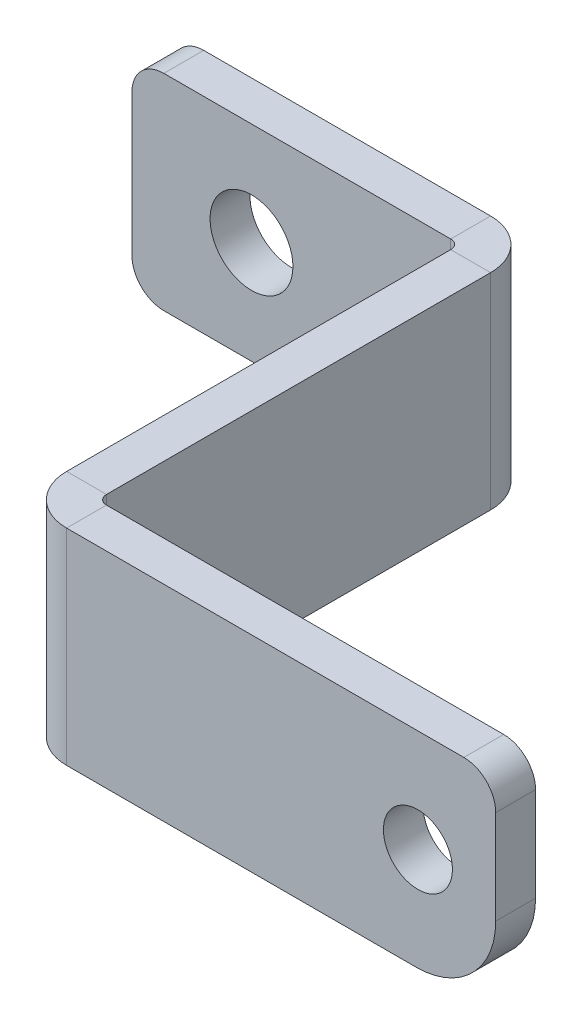
from build123d import *

# Parameters (mm, degrees)
BASE_FLANGE1_DEPTH           = 3.175
M6_CLEARANCE_HOLE1_D         = 6.6
EDGE_FLANGE1_DEPTH           = 16.378
EDGE_FLANGE2_STRIP_W         = 14.1732
EDGE_FLANGE2_STRIP_H         = 3.175
EDGE_FLANGE2_STRIP_CUT_DEPTH = 16.378
EDGE_FLANGE2_DEPTH           = 16.378
M5_CLEARANCE_HOLE1_D         = 5.5
FILLET1_R                    = 2.54
FILLET2_R                    = 6.35


# Sheet-metal steps are written as plain solids
with BuildPart() as part:
    # Sketch1 → Base-Flange1 (new body)
    with BuildSketch(Plane.XY):
        Polygon((52.8905, -45.562600001), (36.5125, -45.562600001), (36.5125, -29.184600001), (61.9125, -29.184600001), (61.9125, -45.562600001), align=None)
    extrude(amount=-BASE_FLANGE1_DEPTH)

    # M6 Clearance Hole1 (through all)
    with Locations(Plane.XY):
        with Locations((46.0375, -37.373600001)):
            Hole(M6_CLEARANCE_HOLE1_D / 2)

    # Edge-Flange1 section (across the edge) → Edge-Flange1 (add)
    with BuildSketch(Plane(origin=(62.6491, -45.562600001, 0), x_dir=(-1, 0, 0), z_dir=(0, 1, 0))):
        with BuildLine():
            Line((-3.175, 0.7366), (-3.175, 32.0779))
            Line((-3.175, 32.0779), (0, 32.0779))
            Line((0, 32.0779), (0, 0.7366))
            ThreePointArc((0, 0.7366), (0.215745145, 0.215745145), (0.7366, 0))
            Line((0.7366, 0), (0.7366, -3.175))
            ThreePointArc((0.7366, -3.175), (-2.029318885, -2.029318885), (-3.175, 0.7366))
        make_face()
    extrude(amount=EDGE_FLANGE1_DEPTH)

    # Edge-Flange2 strip (across the edge) → Edge-Flange2 strip cut (cut)
    with BuildSketch(Plane(origin=(65.8241, -29.184600001, 32.0779), x_dir=(0, 0, -1), z_dir=(0, -1, 0))):
        with Locations((-6.35, -1.5875)):
            Rectangle(EDGE_FLANGE2_STRIP_W, EDGE_FLANGE2_STRIP_H)
    extrude(amount=EDGE_FLANGE2_STRIP_CUT_DEPTH, mode=Mode.SUBTRACT)

    # Edge-Flange2 section (across the edge) → Edge-Flange2 (add)
    with BuildSketch(Plane(origin=(65.8241, -29.184600001, 32.0779), x_dir=(0, 0, -1), z_dir=(0, -1, 0))):
        with BuildLine():
            Line((-3.175, 0.7366), (-3.175, 34.925))
            Line((-3.175, 34.925), (0, 34.925))
            Line((0, 34.925), (0, 0.7366))
            ThreePointArc((0, 0.7366), (0.215745145, 0.215745145), (0.7366, 0))
            Line((0.7366, 0), (0.7366, -3.175))
            ThreePointArc((0.7366, -3.175), (-2.029318885, -2.029318885), (-3.175, 0.7366))
        make_face()
    extrude(amount=EDGE_FLANGE2_DEPTH)

    # M5 Clearance Hole1 (through all)
    with Locations(Plane.XY.offset(35.2529)):
        with Locations((94.5499, -37.373600001)):
            Hole(M5_CLEARANCE_HOLE1_D / 2)

    # Fillet1
    fillet1_edges = [part.edges().sort_by_distance(p)[0] for p in [
        (100.7491, -29.184600001, 33.6654),
        (36.5125, -45.562600001, -1.5875),
        (36.5125, -29.184600001, -1.5875),
    ]]
    fillet(fillet1_edges, radius=FILLET1_R)

    # Fillet2
    fillet2_edges = [part.edges().sort_by_distance(p)[0] for p in [
        (100.7491, -45.562600001, 33.6654),
    ]]
    fillet(fillet2_edges, radius=FILLET2_R)


solid = part.part
